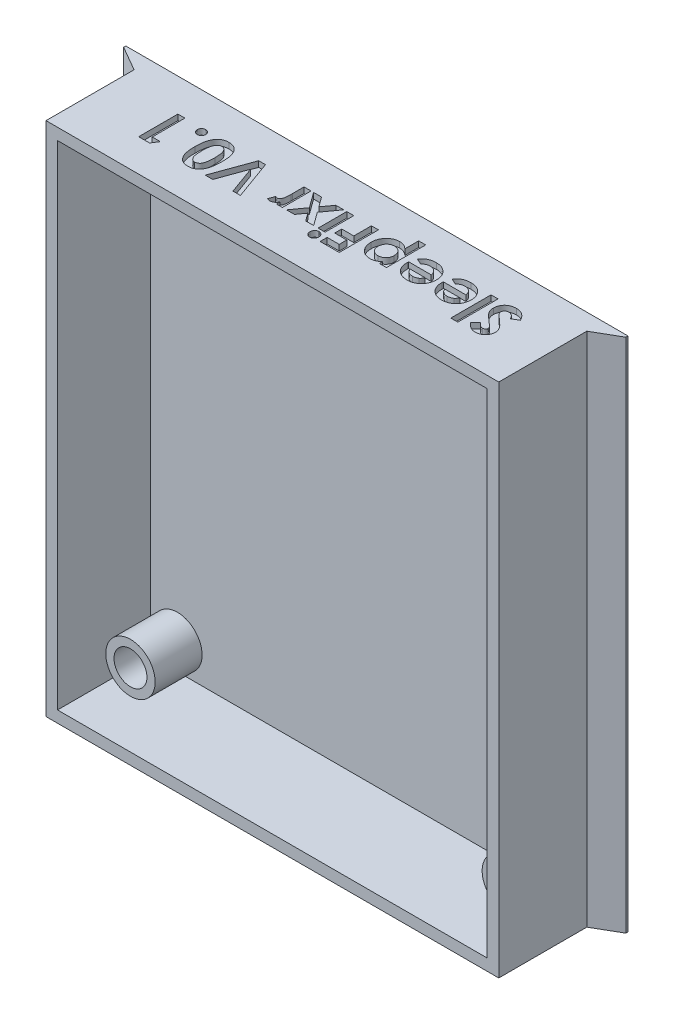
from build123d import *

# Parameters (mm, degrees)
SKETCH1_W                 = 55
SKETCH1_H                 = 62.7
BOSS_EXTRUDE1_DEPTH       = 12.7
SHELL1_T                  = -1.4
SKETCH2_R                 = 3
SKETCH2_R_2               = 2
BOSS_EXTRUDE2_DEPTH       = 5.7
SKETCH3_W                 = 3
SKETCH3_H                 = 62.7
BOSS_EXTRUDE3_DEPTH       = 2
CHAMFER1_SIZE2            = 3
CHAMFER1_SIZE             = 1.732050808
CHAMFER1_OF_MIRROR1_SIZE2 = 1.732050808
CHAMFER1_OF_MIRROR1_SIZE  = 3
SKETCH4_W                 = 0.854807692
SKETCH4_H                 = 3.480288462
SKETCH4_H_2               = 4.884615385
CUT_EXTRUDE1_DEPTH        = 0.7


with BuildPart() as part:
    # Sketch1 → Boss-Extrude1 (new body)
    with BuildSketch(Plane.XY):
        Rectangle(SKETCH1_W, SKETCH1_H)
    extrude(amount=BOSS_EXTRUDE1_DEPTH)

    # Shell1
    shell1_openings = [part.faces().sort_by_distance(p)[0] for p in [
        (0, 0, 12.7),
    ]]
    offset(amount=SHELL1_T, openings=shell1_openings, kind=Kind.INTERSECTION)

    # Sketch2 → Boss-Extrude2 (add)
    # profile 1 of 3: a face of its own
    with BuildSketch(Plane.XY.offset(1.4)):
        with Locations((22.882499365, 26.652311405)):
            Circle(SKETCH2_R)
        with Locations((22.882499365, 26.652311405)):
            Circle(SKETCH2_R_2, mode=Mode.SUBTRACT)
    # profile 2 of 3: a face of its own
    with BuildSketch(Plane.XY.offset(1.4)):
        with Locations((22.882499365, -26.687795276)):
            Circle(SKETCH2_R)
        with Locations((22.882499365, -26.687795276)):
            Circle(SKETCH2_R_2, mode=Mode.SUBTRACT)
    # profile 3 of 3: a face of its own
    with BuildSketch(Plane.XY.offset(1.4)):
        with Locations((-22.837592075, -26.687795276)):
            Circle(SKETCH2_R)
        with Locations((-22.837592075, -26.687795276)):
            Circle(SKETCH2_R_2, mode=Mode.SUBTRACT)
    extrude(amount=BOSS_EXTRUDE2_DEPTH)

    # Sketch3 → Boss-Extrude3 (add)
    with BuildSketch(Plane(origin=(0, 0, 0), x_dir=(-1, 0, 0), z_dir=(0, 0, -1))):
        with Locations((-29, 0)):
            Rectangle(SKETCH3_W, SKETCH3_H)
    boss_extrude3 = extrude(amount=-BOSS_EXTRUDE3_DEPTH)

    # Chamfer1
    chamfer1_edges = [part.edges().sort_by_distance(p)[0] for p in [
        (30.5, 0, 2),
    ]]
    chamfer1_side = [part.faces().sort_by_distance(p)[0] for p in [
        (30.5, 0, 1.965358984),
    ]]
    chamfer(chamfer1_edges, length=CHAMFER1_SIZE - 0.0001, length2=CHAMFER1_SIZE2 - 0.0001, reference=chamfer1_side[0])  # a hair under: the kernel refuses the full size

    # Mirror1: Boss-Extrude3 across plane
    add(boss_extrude3.mirror(Plane.ZY))

    # Chamfer1 of Mirror1
    chamfer1_of_mirror1_edges = [part.edges().sort_by_distance(p)[0] for p in [
        (-30.5, 0, 2),
    ]]
    chamfer1_of_mirror1_side = [part.faces().sort_by_distance(p)[0] for p in [
        (-30.465358984, 0, 2),
    ]]
    chamfer(chamfer1_of_mirror1_edges, length=CHAMFER1_OF_MIRROR1_SIZE - 0.0001, length2=CHAMFER1_OF_MIRROR1_SIZE2 - 0.0001, reference=chamfer1_of_mirror1_side[0])  # a hair under: the kernel refuses the full size

    # Sketch4 → Cut-Extrude1 (cut)
    # profile 1 of 14: a face of its own
    with BuildSketch(Plane(origin=(0, 31.35, 0), x_dir=(1, 0, 0), z_dir=(0, 1, 0))):
        Polygon((-18.858240685, -8.7625), (-20.179567308, -8.7625), (-20.179567308, -4), (-19.324759615, -4), (-19.324759615, -7.96875), (-18.347836538, -7.96875), align=None)
    # profile 2 of 14: a face of its own
    with BuildSketch(Plane(origin=(0, 31.35, 0), x_dir=(1, 0, 0), z_dir=(0, 1, 0))):
        with BuildLine():
            add(Edge.make_bspline(
                [(-16.851923077, -4.976923077), (-16.88648121, -4.975170656), (-16.954609534, -4.971715911), (-17.052252057, -4.941816778), (-17.142258153, -4.89417224), (-17.221144645, -4.828234163), (-17.288485226, -4.750349167), (-17.335515267, -4.660366441), (-17.365951292, -4.562915366), (-17.369233546, -4.494736101), (-17.370913462, -4.459840745)],
                knots=[0, 0, 0, 0, 1.016706445, 2.004347467, 2.981433789, 4.000427929, 5.018214116, 5.995300439, 6.973959266, 8, 8, 8, 8], degree=3))
            add(Edge.make_bspline(
                [(-17.370913462, -4.459840745), (-17.369191428, -4.424958845), (-17.365811807, -4.356500506), (-17.335769318, -4.258581962), (-17.288208584, -4.168278777), (-17.221231288, -4.08954172), (-17.14227775, -4.022784714), (-17.052508806, -3.973871808), (-16.95458068, -3.94420686), (-16.886471499, -3.940714042), (-16.851923077, -3.938942308)],
                knots=[0, 0, 0, 0, 1.022642663, 2.007012786, 2.980863166, 4.002438329, 5.024013493, 6.00229059, 6.986660713, 8, 8, 8, 8], degree=3))
            add(Edge.make_bspline(
                [(-16.851923077, -3.938942308), (-16.817382841, -3.94072857), (-16.7492898, -3.944250029), (-16.65151363, -3.973624158), (-16.562402693, -4.023115211), (-16.483468551, -4.089460528), (-16.416791152, -4.168562207), (-16.367858545, -4.258292848), (-16.338103239, -4.356538162), (-16.334677981, -4.424971556), (-16.332932692, -4.459840745)],
                knots=[0, 0, 0, 0, 1.013817282, 1.998651736, 2.969187861, 3.991244904, 5.013301947, 5.9920405, 6.976874954, 8, 8, 8, 8], degree=3))
            add(Edge.make_bspline(
                [(-16.332932692, -4.459840745), (-16.334635886, -4.494723381), (-16.337963621, -4.562877794), (-16.368115617, -4.660653997), (-16.416511774, -4.750067386), (-16.483556563, -4.828314372), (-16.562417355, -4.893844409), (-16.65177368, -4.942064004), (-16.749260352, -4.971673069), (-16.817372931, -4.975156238), (-16.851923077, -4.976923077)],
                knots=[0, 0, 0, 0, 1.02653117, 2.005657786, 2.987654694, 4.005927372, 5.02540858, 5.994694477, 6.98280758, 8, 8, 8, 8], degree=3))
        make_face()
    # profile 3 of 14: a face of its own
    with BuildSketch(Plane(origin=(0, 31.35, 0), x_dir=(1, 0, 0), z_dir=(0, 1, 0))):
        with BuildLine():
            add(Edge.make_bspline(
                [(-14.090016526, -8.884615385), (-14.131392873, -8.884001347), (-14.212749825, -8.882793985), (-14.332571477, -8.869710007), (-14.447999865, -8.849958815), (-14.559453887, -8.822359472), (-14.666249998, -8.7860242), (-14.768851011, -8.741796178), (-14.867507786, -8.690496318), (-14.961328007, -8.630061593), (-15.049930649, -8.561298126), (-15.133926284, -8.484413284), (-15.211581014, -8.398158905), (-15.285654036, -8.304640584), (-15.35320699, -8.201797888), (-15.416166297, -8.091308967), (-15.4735746, -7.971992628), (-15.526232682, -7.843767138), (-15.573338021, -7.704677635), (-15.612903438, -7.553116455), (-15.647300257, -7.389191281), (-15.674388775, -7.212048399), (-15.69656007, -7.022105588), (-15.711046552, -6.819007443), (-15.721124346, -6.603322321), (-15.721937836, -6.455358786), (-15.722355769, -6.379341947)],
                knots=[0, 0, 0, 0, 0.879038005, 1.72842358, 2.558443055, 3.366573136, 4.165922485, 4.953092809, 5.739101687, 6.526504095, 7.321412341, 8.120218626, 8.943108119, 9.785446297, 10.653345205, 11.555363108, 12.486387694, 13.465363381, 14.499809521, 15.604758044, 16.79243262, 18.058048538, 19.411969755, 20.855614229, 22.384559651, 24, 24, 24, 24], degree=3))
            add(Edge.make_bspline(
                [(-15.722355769, -6.379341947), (-15.721900857, -6.302374545), (-15.721016969, -6.152828264), (-15.711496236, -5.935163625), (-15.695095899, -5.730614329), (-15.67397423, -5.539196155), (-15.644987344, -5.361028441), (-15.611282511, -5.195889022), (-15.570647072, -5.043735715), (-15.522245464, -4.904593165), (-15.469637457, -4.775939798), (-15.41257836, -4.656802745), (-15.351105136, -4.54624768), (-15.285883887, -4.444015781), (-15.214764529, -4.351373911), (-15.140687291, -4.266969626), (-15.061537784, -4.191984269), (-14.978593936, -4.124810328), (-14.889815899, -4.066013824), (-14.795600537, -4.01549885), (-14.695310414, -3.973753165), (-14.590404965, -3.937770904), (-14.479017814, -3.911883424), (-14.36286885, -3.891359471), (-14.240660863, -3.880013002), (-14.157456194, -3.878605721), (-14.114821214, -3.877884615)],
                knots=[0, 0, 0, 0, 1.643729521, 3.193736973, 4.651750042, 6.025799905, 7.305391353, 8.505533933, 9.624215592, 10.665924642, 11.64969722, 12.591402044, 13.485259159, 14.34997443, 15.17859563, 15.977254476, 16.745893235, 17.504291679, 18.254003551, 19.016677942, 19.783634514, 20.571857866, 21.382327253, 22.223106266, 23.08950026, 24, 24, 24, 24], degree=3))
            add(Edge.make_bspline(
                [(-14.114821214, -3.877884615), (-14.0721883, -3.87862288), (-13.988671048, -3.88006913), (-13.866119735, -3.89123908), (-13.74909686, -3.912149227), (-13.636659091, -3.937585901), (-13.529875844, -3.974021319), (-13.427531096, -4.016147142), (-13.331374104, -4.068309221), (-13.239630268, -4.126593609), (-13.15376756, -4.193777083), (-13.072508088, -4.26878801), (-12.994716578, -4.350579274), (-12.923164073, -4.441991758), (-12.856571092, -4.541356), (-12.794230202, -4.64865804), (-12.737410367, -4.764249057), (-12.684200612, -4.888096176), (-12.637158607, -5.023177678), (-12.596453692, -5.170736525), (-12.562546797, -5.332040342), (-12.533518644, -5.506374067), (-12.513837155, -5.694742298), (-12.497059724, -5.896034588), (-12.48766062, -6.110852747), (-12.486761168, -6.258490179), (-12.486298077, -6.334502704)],
                knots=[0, 0, 0, 0, 0.917300563, 1.796978314, 2.644037383, 3.473869551, 4.274468802, 5.068727038, 5.852392514, 6.624895937, 7.405058545, 8.194438634, 9.002807344, 9.831001702, 10.688798588, 11.574866558, 12.499006576, 13.458565112, 14.473491784, 15.574131657, 16.749764288, 18.018652109, 19.374999853, 20.823441246, 22.364518758, 24, 24, 24, 24], degree=3))
            add(Edge.make_bspline(
                [(-12.486298077, -6.334502704), (-12.487127376, -6.440115737), (-12.488727519, -6.643897444), (-12.508485798, -6.938344289), (-12.538374699, -7.210307689), (-12.579290307, -7.460116252), (-12.634399174, -7.687281024), (-12.702029687, -7.891736753), (-12.779631168, -8.075507288), (-12.845652456, -8.184391695), (-12.877448918, -8.23683143)],
                knots=[0, 0, 0, 0, 1.288526675, 2.486228817, 3.599112392, 4.626206381, 5.5730174, 6.447949553, 7.252518174, 8, 8, 8, 8], degree=3))
            add(Edge.make_bspline(
                [(-12.877448918, -8.23683143), (-12.91442772, -8.288346782), (-12.986728563, -8.389069447), (-13.113148608, -8.521299478), (-13.248970487, -8.634389076), (-13.396983903, -8.725778921), (-13.554847964, -8.79784896), (-13.723918011, -8.848751217), (-13.903569698, -8.878409244), (-14.026939508, -8.882515779), (-14.090016526, -8.884615385)],
                knots=[0, 0, 0, 0, 1.058512271, 2.069600068, 3.047294572, 4.004278952, 4.967380941, 5.939006123, 6.946246673, 8, 8, 8, 8], degree=3))
        make_face()
        with BuildLine():
            add(Edge.make_bspline(
                [(-14.111005108, -8.029807692), (-14.073611374, -8.028015768), (-14.000299806, -8.024502646), (-13.894017316, -7.995347455), (-13.794674918, -7.948992675), (-13.71778794, -7.895722875), (-13.661145954, -7.842649374), (-13.619902509, -7.796143311), (-13.582979834, -7.741708937), (-13.547395709, -7.681727301), (-13.51541174, -7.614370305), (-13.484590672, -7.541443877), (-13.458253375, -7.461117968), (-13.433074809, -7.374080335), (-13.411344946, -7.278176415), (-13.392190519, -7.172509366), (-13.376450876, -7.05661105), (-13.362718939, -6.93035352), (-13.354113348, -6.793764977), (-13.345743382, -6.646879243), (-13.342702885, -6.489383651), (-13.341649429, -6.380931524), (-13.341105769, -6.32496244)],
                knots=[0, 0, 0, 0, 1.076633864, 2.110773886, 3.152647947, 4.225997476, 4.790367519, 5.388085217, 6.013768813, 6.68363944, 7.397140436, 8.161658524, 8.964785566, 9.832512219, 10.773307679, 11.798385074, 12.927758018, 14.144797317, 15.459104848, 16.872968649, 18.386227327, 20, 20, 20, 20], degree=3))
            add(Edge.make_bspline(
                [(-13.341105769, -6.32496244), (-13.341978709, -6.252450261), (-13.343652635, -6.113402782), (-13.352395034, -5.913448599), (-13.370023761, -5.731157324), (-13.391718636, -5.565935193), (-13.422111422, -5.418301448), (-13.459325946, -5.28829328), (-13.500792204, -5.174451795), (-13.552757411, -5.07872825), (-13.608438676, -4.9968658), (-13.667868459, -4.926050491), (-13.732084681, -4.867060525), (-13.799167547, -4.816979208), (-13.871604864, -4.779790903), (-13.947911255, -4.752679431), (-14.028256117, -4.736148924), (-14.08326266, -4.733851174), (-14.111005108, -4.732692308)],
                knots=[0, 0, 0, 0, 1.772038313, 3.39801485, 4.888833602, 6.246074539, 7.468356166, 8.567794639, 9.549176812, 10.42180448, 11.221452581, 11.965716786, 12.675085657, 13.348110381, 14.005015947, 14.656336226, 15.322325655, 16, 16, 16, 16], degree=3))
            add(Edge.make_bspline(
                [(-14.111005108, -4.732692308), (-14.137796557, -4.73348435), (-14.190250881, -4.735035069), (-14.266741034, -4.750952999), (-14.339075557, -4.776832094), (-14.407036051, -4.813439892), (-14.4708656, -4.859992308), (-14.530252246, -4.916693913), (-14.584748105, -4.98410989), (-14.61649764, -5.034142516), (-14.632857572, -5.059923377)],
                knots=[0, 0, 0, 0, 0.992283464, 1.942767638, 2.88273346, 3.832339453, 4.79467288, 5.803907806, 6.868395428, 8, 8, 8, 8], degree=3))
            add(Edge.make_bspline(
                [(-14.632857572, -5.059923377), (-14.652124585, -5.095150923), (-14.692525947, -5.169020228), (-14.73915991, -5.293696712), (-14.778942253, -5.434134081), (-14.81083286, -5.591467852), (-14.836092362, -5.76506673), (-14.855403256, -5.955059738), (-14.865211909, -6.161719212), (-14.866749152, -6.304919082), (-14.867548077, -6.379341947)],
                knots=[0, 0, 0, 0, 0.710996797, 1.490902623, 2.352723643, 3.296875318, 4.334065587, 5.461510359, 6.680713396, 8, 8, 8, 8], degree=3))
            add(Edge.make_bspline(
                [(-14.867548077, -6.379341947), (-14.867233962, -6.454408529), (-14.866629345, -6.598898885), (-14.855536352, -6.80633178), (-14.840088536, -6.995787332), (-14.817492763, -7.166842438), (-14.78841943, -7.31991275), (-14.752585697, -7.454986975), (-14.710342698, -7.572335375), (-14.660240272, -7.671828194), (-14.604771604, -7.756413374), (-14.545814382, -7.828880671), (-14.483266652, -7.891269361), (-14.416454493, -7.941838043), (-14.345823774, -7.982142572), (-14.270993412, -8.009609255), (-14.192212338, -8.026505836), (-14.138439549, -8.028692218), (-14.111005108, -8.029807692)],
                knots=[0, 0, 0, 0, 1.793903324, 3.452957663, 4.963427329, 6.336122014, 7.574844885, 8.684777121, 9.673127442, 10.55010789, 11.340650774, 12.086136756, 12.779466299, 13.446812155, 14.083183996, 14.715685896, 15.34475337, 16, 16, 16, 16], degree=3))
        make_face(mode=Mode.SUBTRACT)
    # profile 4 of 14: a face of its own
    with BuildSketch(Plane(origin=(0, 31.35, 0), x_dir=(1, 0, 0), z_dir=(0, 1, 0))):
        Polygon((-7.815384615, -8.7625), (-8.728387921, -8.7625), (-9.952403846, -5.379522236), (-11.179281851, -8.7625), (-12.089423077, -8.7625), (-10.362635216, -4), (-9.539310397, -4), align=None)
    # profile 5 of 14: a face of its own
    with BuildSketch(Plane(origin=(0, 31.35, 0), x_dir=(1, 0, 0), z_dir=(0, 1, 0))):
        with BuildLine():
            Line((-3.999278846, -7.480288462), (-4.731971154, -7.480288462))
            Line((-4.731971154, -7.480288462), (-4.731971154, -7.051930589))
            add(Edge.make_bspline(
                [(-4.731971154, -7.051930589), (-4.752677091, -7.090020784), (-4.793147705, -7.164469651), (-4.867990155, -7.264219914), (-4.952841229, -7.34973436), (-5.047552476, -7.419057565), (-5.14889311, -7.474176198), (-5.256253464, -7.511979569), (-5.367754596, -7.537438636), (-5.444168735, -7.540034269), (-5.482789964, -7.541346154)],
                knots=[0, 0, 0, 0, 1.098409642, 2.146887215, 3.15060926, 4.142663133, 5.113340811, 6.064933309, 7.021978713, 8, 8, 8, 8], degree=3))
            add(Edge.make_bspline(
                [(-5.482789964, -7.541346154), (-5.510853611, -7.540152582), (-5.568058591, -7.537719604), (-5.654650809, -7.520255162), (-5.743431323, -7.494090346), (-5.801365776, -7.468551476), (-5.831009615, -7.455483774)],
                knots=[0, 0, 0, 0, 0.931681262, 1.899140464, 2.92503444, 4, 4, 4, 4], degree=3))
            Line((-5.831009615, -7.455483774), (-5.565790264, -6.731377704))
            add(Edge.make_bspline(
                [(-5.565790264, -6.731377704), (-5.542083442, -6.742831695), (-5.497523741, -6.764360788), (-5.432830793, -6.789767335), (-5.37411926, -6.805269169), (-5.336897226, -6.807582178), (-5.319651442, -6.808653846)],
                knots=[0, 0, 0, 0, 1.214386998, 2.282580073, 3.20428172, 4, 4, 4, 4], degree=3))
            add(Edge.make_bspline(
                [(-5.319651442, -6.808653846), (-5.303364016, -6.807949719), (-5.271323842, -6.806564581), (-5.224104273, -6.794505283), (-5.17918814, -6.774137433), (-5.136242802, -6.746304674), (-5.095371153, -6.710871191), (-5.056011281, -6.668063715), (-5.020819005, -6.615636757), (-4.983808079, -6.557112416), (-4.952284203, -6.48553132), (-4.925151654, -6.400078714), (-4.901487008, -6.299637689), (-4.882923322, -6.184203804), (-4.869043506, -6.053924367), (-4.858835513, -5.908818528), (-4.851931321, -5.748796658), (-4.851466637, -5.637117264), (-4.851224459, -5.578913762)],
                knots=[0, 0, 0, 0, 0.544259334, 1.070651881, 1.618331981, 2.187895439, 2.776420197, 3.424094598, 4.12659612, 4.885633066, 5.737955424, 6.733832302, 7.882163033, 9.186958323, 10.642647142, 12.264016219, 14.052932313, 16, 16, 16, 16], degree=3))
            Line((-4.851224459, -5.578913762), (-4.854086538, -5.409097055))
            Line((-4.854086538, -5.409097055), (-4.854086538, -4))
            Line((-4.854086538, -4), (-3.999278846, -4))
            Line((-3.999278846, -4), (-3.999278846, -7.480288462))
        make_face()
    # profile 6 of 14: a face of its own
    with BuildSketch(Plane(origin=(0, 31.35, 0), x_dir=(1, 0, 0), z_dir=(0, 1, 0))):
        Polygon((-0.205115685, -7.480288462), (-1.169636418, -7.480288462), (-1.857489483, -6.531986178), (-2.542480469, -7.480288462), (-3.507001202, -7.480288462), (-2.341180889, -5.865121695), (-3.693990385, -4), (-2.729469651, -4), (-1.860351563, -5.198257212), (-0.995049579, -4), (-0.030528846, -4), (-1.376660156, -5.865121695), align=None)
    # profile 7 of 14: a face of its own
    with BuildSketch(Plane(origin=(0, 31.35, 0), x_dir=(1, 0, 0), z_dir=(0, 1, 0))):
        with BuildLine():
            add(Edge.make_bspline(
                [(0.765129207, -8.945673077), (0.728273823, -8.943887674), (0.655904726, -8.940381862), (0.552602814, -8.905513953), (0.456864249, -8.852567993), (0.373271994, -8.777720228), (0.302544887, -8.68904888), (0.251414064, -8.588072782), (0.219530178, -8.478198127), (0.215671751, -8.401777603), (0.213701923, -8.362762921)],
                knots=[0, 0, 0, 0, 0.989651449, 1.943275965, 2.90597644, 3.919767043, 4.944608933, 5.944551278, 6.950639519, 8, 8, 8, 8], degree=3))
            add(Edge.make_bspline(
                [(0.213701923, -8.362762921), (0.215795756, -8.324106465), (0.219892293, -8.248475986), (0.249893318, -8.139295447), (0.302163384, -8.040518812), (0.371136012, -7.951961084), (0.45538415, -7.879684457), (0.548363394, -7.823993045), (0.651081646, -7.791390775), (0.722292801, -7.787534824), (0.758451022, -7.785576923)],
                knots=[0, 0, 0, 0, 1.052725588, 2.059633778, 3.055596988, 4.079986438, 5.099674807, 6.062641398, 7.01628558, 8, 8, 8, 8], degree=3))
            add(Edge.make_bspline(
                [(0.758451022, -7.785576923), (0.795601669, -7.787400076), (0.868548432, -7.79097991), (0.973380691, -7.825393409), (1.069153625, -7.880618302), (1.153376729, -7.956306476), (1.223328106, -8.046203859), (1.276735622, -8.146774626), (1.306577937, -8.258377079), (1.31065072, -8.335562801), (1.312740385, -8.375165264)],
                knots=[0, 0, 0, 0, 0.989280592, 1.942491504, 2.912382296, 3.922750976, 4.94514089, 5.940052451, 6.943081751, 8, 8, 8, 8], degree=3))
            add(Edge.make_bspline(
                [(1.312740385, -8.375165264), (1.310629595, -8.413191266), (1.306483255, -8.487887857), (1.276459788, -8.595730711), (1.224451552, -8.694095969), (1.153858837, -8.780398004), (1.071520342, -8.854511955), (0.976406417, -8.906771317), (0.873530152, -8.940013367), (0.801635952, -8.943767027), (0.765129207, -8.945673077)],
                knots=[0, 0, 0, 0, 1.038763745, 2.040501419, 3.031928819, 4.058179968, 5.07455544, 6.03952971, 7.004503979, 8, 8, 8, 8], degree=3))
        make_face()
    # profile 8 of 14: a face of its own
    with BuildSketch(Plane(origin=(0, 31.35, 0), x_dir=(1, 0, 0), z_dir=(0, 1, 0))):
        with Locations((0.763221154, -5.740144231)):
            Rectangle(SKETCH4_W, SKETCH4_H)
    # profile 9 of 14: a face of its own
    with BuildSketch(Plane(origin=(0, 31.35, 0), x_dir=(1, 0, 0), z_dir=(0, 1, 0))):
        Polygon((4.182451923, -8.7625), (1.862259615, -8.7625), (1.862259615, -7.907692308), (3.327644231, -7.907692308), (3.327644231, -6.991826923), (1.862259615, -6.991826923), (1.862259615, -6.137019231), (3.327644231, -6.137019231), (3.327644231, -4), (4.182451923, -4), align=None)
    # profile 10 of 14: a face of its own
    with BuildSketch(Plane(origin=(0, 31.35, 0), x_dir=(1, 0, 0), z_dir=(0, 1, 0))):
        with BuildLine():
            Line((7.784855769, -7.480288462), (7.784855769, -7.088183594))
            add(Edge.make_bspline(
                [(7.784855769, -7.088183594), (7.745167826, -7.124639605), (7.6672248, -7.19623545), (7.539662981, -7.287996986), (7.408258311, -7.366499054), (7.271896212, -7.430851243), (7.130841843, -7.481453674), (6.984283053, -7.514381872), (6.833516284, -7.538309756), (6.731072946, -7.540324683), (6.679139123, -7.541346154)],
                knots=[0, 0, 0, 0, 1.054187817, 2.070316091, 3.069675674, 4.047174656, 5.017909683, 5.996439029, 6.984291385, 8, 8, 8, 8], degree=3))
            add(Edge.make_bspline(
                [(6.679139123, -7.541346154), (6.623080641, -7.540005596), (6.512663622, -7.537365132), (6.35022541, -7.512641962), (6.194482415, -7.472843373), (6.045329949, -7.416742424), (5.901935275, -7.345981096), (5.765620001, -7.257858216), (5.636227924, -7.153581984), (5.513536177, -7.036119509), (5.401833593, -6.905530147), (5.303964812, -6.764612963), (5.221172443, -6.614799841), (5.154596233, -6.455586077), (5.101931512, -6.287603601), (5.063599791, -6.110803569), (5.041760084, -5.924822071), (5.038779217, -5.798078177), (5.037259615, -5.733466046)],
                knots=[0, 0, 0, 0, 0.985951178, 1.942003901, 2.883982064, 3.810134859, 4.741144248, 5.692715104, 6.660213483, 7.661561108, 8.67767141, 9.678956482, 10.675837386, 11.68402661, 12.710593111, 13.769816723, 14.863086109, 16, 16, 16, 16], degree=3))
            add(Edge.make_bspline(
                [(5.037259615, -5.733466046), (5.038706577, -5.671068664), (5.041558857, -5.548069667), (5.064667857, -5.367513283), (5.103673281, -5.194968643), (5.158905594, -5.030785763), (5.227001582, -4.873501803), (5.312804457, -4.724649372), (5.414606021, -4.584357989), (5.529440846, -4.452399836), (5.654672622, -4.332239153), (5.788234887, -4.228052927), (5.926115226, -4.137941742), (6.070874794, -4.065363619), (6.221451121, -4.008476412), (6.377688256, -3.969036543), (6.539270418, -3.942578832), (6.649138822, -3.940166556), (6.704897837, -3.938942308)],
                knots=[0, 0, 0, 0, 1.098516344, 2.165417921, 3.19923846, 4.20863973, 5.211651828, 6.212566914, 7.227467783, 8.259481857, 9.28930572, 10.278496837, 11.238453968, 12.185121121, 13.124355233, 14.066972242, 15.018974356, 16, 16, 16, 16], degree=3))
            add(Edge.make_bspline(
                [(6.704897837, -3.938942308), (6.754578526, -3.94017476), (6.852446495, -3.942602618), (6.996537651, -3.963384426), (7.135320506, -3.996483746), (7.269526724, -4.043974001), (7.401151726, -4.105813794), (7.531023051, -4.184735937), (7.660578548, -4.280693365), (7.74254123, -4.354800109), (7.784855769, -4.393058894)],
                knots=[0, 0, 0, 0, 0.991011278, 1.952232586, 2.89886686, 3.834201722, 4.788083509, 5.795919256, 6.862108243, 8, 8, 8, 8], degree=3))
            Line((7.784855769, -4.393058894), (7.784855769, -2.717788462))
            Line((7.784855769, -2.717788462), (8.639663462, -2.717788462))
            Line((8.639663462, -2.717788462), (8.639663462, -7.480288462))
            Line((8.639663462, -7.480288462), (7.784855769, -7.480288462))
        make_face()
        with BuildLine():
            add(Edge.make_bspline(
                [(6.864220252, -6.747596154), (6.898911009, -6.746529533), (6.96692375, -6.744438376), (7.06677697, -6.732450409), (7.161396765, -6.709905867), (7.252188431, -6.68065054), (7.338124096, -6.641291829), (7.419290648, -6.59320061), (7.496690186, -6.537800658), (7.567333181, -6.47254592), (7.633542492, -6.40212396), (7.689469524, -6.323771487), (7.739105159, -6.241775312), (7.778060108, -6.153088795), (7.808487176, -6.05940741), (7.830682338, -5.960765063), (7.842812479, -5.8568377), (7.844863452, -5.785967145), (7.845913462, -5.749684495)],
                knots=[0, 0, 0, 0, 1.060361231, 2.078884446, 3.066575369, 4.028447752, 4.989534372, 5.947865746, 6.908116788, 7.891927729, 8.882292221, 9.856117424, 10.827758235, 11.806564921, 12.808401015, 13.833992741, 14.891098244, 16, 16, 16, 16], degree=3))
            add(Edge.make_bspline(
                [(7.845913462, -5.749684495), (7.844849247, -5.712767313), (7.842760679, -5.640315755), (7.830744983, -5.534166076), (7.808656877, -5.433570103), (7.77786474, -5.338426195), (7.739112909, -5.248119188), (7.689756454, -5.164319154), (7.633527743, -5.084901118), (7.567404263, -5.013426619), (7.496411718, -4.94737098), (7.419601754, -4.889956537), (7.338402368, -4.840658305), (7.251768142, -4.802127491), (7.16181841, -4.769783605), (7.066715274, -4.748017753), (6.966940121, -4.735802402), (6.898916539, -4.733742822), (6.864220252, -4.732692308)],
                knots=[0, 0, 0, 0, 1.117458908, 2.193061219, 3.227575974, 4.228922649, 5.21592104, 6.19481524, 7.167063136, 8.15499956, 9.135831651, 10.098264655, 11.052287748, 12.004123772, 12.962940859, 13.941125115, 14.949844898, 16, 16, 16, 16], degree=3))
            add(Edge.make_bspline(
                [(6.864220252, -4.732692308), (6.83078246, -4.733656014), (6.764594811, -4.735563599), (6.667511284, -4.749274595), (6.574225677, -4.77068892), (6.485737269, -4.803142763), (6.400467805, -4.842616266), (6.320068551, -4.89307302), (6.243426102, -4.951514483), (6.171451835, -5.017836868), (6.105537845, -5.091002925), (6.048473764, -5.170101614), (5.999939554, -5.254087642), (5.961261837, -5.343331611), (5.929196112, -5.436897764), (5.907291126, -5.536076643), (5.895242434, -5.639989258), (5.893136198, -5.71085757), (5.892067308, -5.746822416)],
                knots=[0, 0, 0, 0, 1.021655464, 2.022291768, 2.991178077, 3.941111595, 4.897585522, 5.857755741, 6.835521975, 7.839739059, 8.844614369, 9.839997705, 10.815248905, 11.803059053, 12.808075355, 13.833790882, 14.900674009, 16, 16, 16, 16], degree=3))
            add(Edge.make_bspline(
                [(5.892067308, -5.746822416), (5.893151822, -5.782464393), (5.895288618, -5.852689067), (5.907111159, -5.955726482), (5.929785127, -6.05349909), (5.958842721, -6.14687999), (5.998094122, -6.234832207), (6.046754982, -6.31724977), (6.1015603, -6.396290131), (6.166740553, -6.468149836), (6.237750642, -6.533456334), (6.313253598, -6.591486237), (6.394152026, -6.639395943), (6.479714194, -6.678452123), (6.569230344, -6.710294359), (6.663609216, -6.732311179), (6.76245531, -6.744476882), (6.829843007, -6.746542432), (6.864220252, -6.747596154)],
                knots=[0, 0, 0, 0, 1.094449365, 2.156371669, 3.177111318, 4.171221881, 5.154488592, 6.125613636, 7.106114198, 8.101661685, 9.096538865, 10.064961488, 11.019258098, 11.975848813, 12.948395745, 13.931080756, 14.94455893, 16, 16, 16, 16], degree=3))
        make_face(mode=Mode.SUBTRACT)
    # profile 11 of 14: a face of its own
    with BuildSketch(Plane(origin=(0, 31.35, 0), x_dir=(1, 0, 0), z_dir=(0, 1, 0))):
        with BuildLine():
            Line((9.375217849, -5.526442308), (12.119951923, -5.526442308))
            add(Edge.make_bspline(
                [(12.119951923, -5.526442308), (12.11434155, -5.49455528), (12.103316726, -5.431894754), (12.079711608, -5.341076006), (12.048553468, -5.255551934), (12.012718287, -5.174620013), (11.970785765, -5.098566637), (11.921271684, -5.028406017), (11.86633355, -4.962694314), (11.804930601, -4.902392536), (11.738635944, -4.848200983), (11.667268823, -4.801089219), (11.591991693, -4.760874157), (11.511945027, -4.72841646), (11.427770947, -4.702381137), (11.338911343, -4.684517928), (11.245684239, -4.673942859), (11.1821719, -4.672415393), (11.149707031, -4.671634615)],
                knots=[0, 0, 0, 0, 1.091578896, 2.145038655, 3.15928737, 4.157766048, 5.127497078, 6.082469626, 7.049112333, 8.012179284, 8.980248595, 9.932024523, 10.891502393, 11.853374471, 12.840501167, 13.858428296, 14.905317556, 16, 16, 16, 16], degree=3))
            add(Edge.make_bspline(
                [(11.149707031, -4.671634615), (11.110520065, -4.672669189), (11.033349388, -4.67470657), (10.920293773, -4.692775108), (10.810952523, -4.720066841), (10.706360395, -4.760651938), (10.60530585, -4.81117325), (10.509452559, -4.874116589), (10.417141375, -4.947642543), (10.360820675, -5.004316321), (10.33210637, -5.033210637)],
                knots=[0, 0, 0, 0, 1.021034703, 2.010718019, 2.977989445, 3.954245119, 4.929443971, 5.918328161, 6.938689359, 8, 8, 8, 8], degree=3))
            Line((10.33210637, -5.033210637), (9.616586538, -4.692623197))
            add(Edge.make_bspline(
                [(9.616586538, -4.692623197), (9.639469372, -4.661518159), (9.684700112, -4.600035219), (9.757573875, -4.51330945), (9.832675047, -4.431728992), (9.912079484, -4.357149263), (9.99509513, -4.289428311), (10.081369185, -4.228263347), (10.170435978, -4.172608154), (10.26293759, -4.122653968), (10.360258657, -4.079999492), (10.460888137, -4.041352533), (10.566735221, -4.010451769), (10.676328242, -3.983077821), (10.790885621, -3.963632888), (10.909630248, -3.949256421), (11.032866545, -3.940522181), (11.116620004, -3.939475187), (11.159247296, -3.938942308)],
                knots=[0, 0, 0, 0, 1.033499484, 2.042839079, 3.030732955, 4.00037446, 4.956353854, 5.896509365, 6.829584737, 7.766535667, 8.707846775, 9.672354793, 10.650035223, 11.657650065, 12.694754689, 13.758082582, 14.858950201, 16, 16, 16, 16], degree=3))
            add(Edge.make_bspline(
                [(11.159247296, -3.938942308), (11.224829948, -3.940279341), (11.353269792, -3.942897843), (11.541136288, -3.967201288), (11.719557334, -4.007499027), (11.889036812, -4.062277585), (12.048841823, -4.13460255), (12.199052546, -4.223061592), (12.3411657, -4.325960541), (12.470854305, -4.445452261), (12.588959857, -4.575531938), (12.69285868, -4.715155372), (12.779277034, -4.863798248), (12.852363691, -5.019042626), (12.905943148, -5.183776922), (12.946385468, -5.355659553), (12.970740107, -5.535922022), (12.973404796, -5.658659667), (12.974759615, -5.721063702)],
                knots=[0, 0, 0, 0, 1.103528868, 2.161197684, 3.181904866, 4.17893931, 5.15400521, 6.128071465, 7.108807125, 8.101535823, 9.090664498, 10.062772592, 11.024896103, 11.980490186, 12.945349712, 13.934753549, 14.949957771, 16, 16, 16, 16], degree=3))
            add(Edge.make_bspline(
                [(12.974759615, -5.721063702), (12.973401803, -5.785057399), (12.970730369, -5.910962123), (12.946480718, -6.095331524), (12.906227008, -6.271262841), (12.850553379, -6.438914267), (12.780588852, -6.599265083), (12.691332325, -6.749606547), (12.588158743, -6.892295221), (12.470351096, -7.025374287), (12.340142203, -7.145541503), (12.201776151, -7.252672164), (12.053864473, -7.341599358), (11.898306136, -7.414215447), (11.735342818, -7.47251766), (11.563296847, -7.511548279), (11.383611803, -7.537707805), (11.260788313, -7.540120092), (11.19836238, -7.541346154)],
                knots=[0, 0, 0, 0, 1.079354094, 2.123580709, 3.131027717, 4.120248802, 5.100347326, 6.076737579, 7.064152558, 8.067633759, 9.069995403, 10.049814825, 11.015114092, 11.975254693, 12.94256508, 13.929104949, 14.947452504, 16, 16, 16, 16], degree=3))
            add(Edge.make_bspline(
                [(11.19836238, -7.541346154), (11.132463807, -7.539992018), (11.003078752, -7.537333313), (10.813928329, -7.513175779), (10.634234411, -7.472817366), (10.463598084, -7.417797526), (10.302345165, -7.345913369), (10.151043755, -7.257525458), (10.008811305, -7.153973601), (9.877610954, -7.034779666), (9.758883558, -6.902887708), (9.654480269, -6.759742251), (9.568024877, -6.605227534), (9.495831457, -6.441511947), (9.440613047, -6.267400377), (9.400577959, -6.083504888), (9.376282389, -5.888988719), (9.373684531, -5.755797753), (9.372355769, -5.687672776)],
                knots=[0, 0, 0, 0, 1.079725433, 2.119929612, 3.118887298, 4.094664154, 5.053604992, 6.006563715, 6.961515899, 7.932002515, 8.906358438, 9.865525889, 10.829453997, 11.80269401, 12.793349889, 13.817750914, 14.883815678, 16, 16, 16, 16], degree=3))
            Line((9.372355769, -5.687672776), (9.375217849, -5.526442308))
        make_face()
        with BuildLine():
            add(Edge.make_bspline(
                [(10.227163462, -6.198076923), (10.243133216, -6.241715287), (10.274849467, -6.328381948), (10.349614155, -6.446142806), (10.44343065, -6.551419108), (10.555943893, -6.642335062), (10.683253712, -6.717235406), (10.823568859, -6.769135115), (10.972847881, -6.803340359), (11.076052331, -6.806858506), (11.12871845, -6.808653846)],
                knots=[0, 0, 0, 0, 0.954548419, 1.89575218, 2.851198576, 3.847292229, 4.862571986, 5.878062886, 6.917157232, 8, 8, 8, 8], degree=3))
            add(Edge.make_bspline(
                [(11.12871845, -6.808653846), (11.186156683, -6.806254154), (11.298346082, -6.801567031), (11.461046352, -6.765252957), (11.613034319, -6.705599417), (11.703574861, -6.647094754), (11.748835637, -6.617848558)],
                knots=[0, 0, 0, 0, 1.045043327, 2.041197553, 3.020804202, 4, 4, 4, 4], degree=3))
            add(Edge.make_bspline(
                [(11.748835637, -6.617848558), (11.77707013, -6.595221128), (11.837454931, -6.546828092), (11.914518498, -6.449658165), (11.992381947, -6.333667058), (12.035809927, -6.245135958), (12.058894231, -6.198076923)],
                knots=[0, 0, 0, 0, 0.821695496, 1.757351177, 2.807911704, 4, 4, 4, 4], degree=3))
            Line((12.058894231, -6.198076923), (10.227163462, -6.198076923))
        make_face(mode=Mode.SUBTRACT)
    # profile 12 of 14: a face of its own
    with BuildSketch(Plane(origin=(0, 31.35, 0), x_dir=(1, 0, 0), z_dir=(0, 1, 0))):
        with BuildLine():
            Line((13.588198618, -5.526442308), (16.332932692, -5.526442308))
            add(Edge.make_bspline(
                [(16.332932692, -5.526442308), (16.32732232, -5.49455528), (16.316297495, -5.431894754), (16.292692377, -5.341076006), (16.261534237, -5.255551934), (16.225699056, -5.174620013), (16.183766535, -5.098566637), (16.134252453, -5.028406017), (16.079314319, -4.962694314), (16.01791137, -4.902392536), (15.951616713, -4.848200983), (15.880249593, -4.801089219), (15.804972463, -4.760874157), (15.724925797, -4.72841646), (15.640751716, -4.702381137), (15.551892112, -4.684517928), (15.458665009, -4.673942859), (15.395152669, -4.672415393), (15.3626878, -4.671634615)],
                knots=[0, 0, 0, 0, 1.091578896, 2.145038655, 3.15928737, 4.157766048, 5.127497078, 6.082469626, 7.049112333, 8.012179284, 8.980248595, 9.932024523, 10.891502393, 11.853374471, 12.840501167, 13.858428296, 14.905317556, 16, 16, 16, 16], degree=3))
            add(Edge.make_bspline(
                [(15.3626878, -4.671634615), (15.323500834, -4.672669189), (15.246330158, -4.67470657), (15.133274542, -4.692775108), (15.023933293, -4.720066841), (14.919341164, -4.760651938), (14.81828662, -4.81117325), (14.722433328, -4.874116589), (14.630122144, -4.947642543), (14.573801444, -5.004316321), (14.545087139, -5.033210637)],
                knots=[0, 0, 0, 0, 1.021034703, 2.010718019, 2.977989445, 3.954245119, 4.929443971, 5.918328161, 6.938689359, 8, 8, 8, 8], degree=3))
            Line((14.545087139, -5.033210637), (13.829567308, -4.692623197))
            add(Edge.make_bspline(
                [(13.829567308, -4.692623197), (13.852450141, -4.661518159), (13.897680881, -4.600035219), (13.970554644, -4.51330945), (14.045655816, -4.431728992), (14.125060253, -4.357149263), (14.208075899, -4.289428311), (14.294349954, -4.228263347), (14.383416747, -4.172608154), (14.475918359, -4.122653968), (14.573239426, -4.079999492), (14.673868906, -4.041352533), (14.77971599, -4.010451769), (14.889309011, -3.983077821), (15.00386639, -3.963632888), (15.122611017, -3.949256421), (15.245847315, -3.940522181), (15.329600773, -3.939475187), (15.372228065, -3.938942308)],
                knots=[0, 0, 0, 0, 1.033499484, 2.042839079, 3.030732955, 4.00037446, 4.956353854, 5.896509365, 6.829584737, 7.766535667, 8.707846775, 9.672354793, 10.650035223, 11.657650065, 12.694754689, 13.758082582, 14.858950201, 16, 16, 16, 16], degree=3))
            add(Edge.make_bspline(
                [(15.372228065, -3.938942308), (15.437810717, -3.940279341), (15.566250562, -3.942897843), (15.754117057, -3.967201288), (15.932538104, -4.007499027), (16.102017582, -4.062277585), (16.261822592, -4.13460255), (16.412033315, -4.223061592), (16.554146469, -4.325960541), (16.683835074, -4.445452261), (16.801940626, -4.575531938), (16.90583945, -4.715155372), (16.992257804, -4.863798248), (17.06534446, -5.019042626), (17.118923918, -5.183776922), (17.159366238, -5.355659553), (17.183720876, -5.535922022), (17.186385565, -5.658659667), (17.187740385, -5.721063702)],
                knots=[0, 0, 0, 0, 1.103528868, 2.161197684, 3.181904866, 4.17893931, 5.15400521, 6.128071465, 7.108807125, 8.101535823, 9.090664498, 10.062772592, 11.024896103, 11.980490186, 12.945349712, 13.934753549, 14.949957771, 16, 16, 16, 16], degree=3))
            add(Edge.make_bspline(
                [(17.187740385, -5.721063702), (17.186382573, -5.785057399), (17.183711138, -5.910962123), (17.159461488, -6.095331524), (17.119207777, -6.271262841), (17.063534148, -6.438914267), (16.993569621, -6.599265083), (16.904313094, -6.749606547), (16.801139512, -6.892295221), (16.683331865, -7.025374287), (16.553122972, -7.145541503), (16.41475692, -7.252672164), (16.266845242, -7.341599358), (16.111286906, -7.414215447), (15.948323587, -7.47251766), (15.776277616, -7.511548279), (15.596592572, -7.537707805), (15.473769082, -7.540120092), (15.411343149, -7.541346154)],
                knots=[0, 0, 0, 0, 1.079354094, 2.123580709, 3.131027717, 4.120248802, 5.100347326, 6.076737579, 7.064152558, 8.067633759, 9.069995403, 10.049814825, 11.015114092, 11.975254693, 12.94256508, 13.929104949, 14.947452504, 16, 16, 16, 16], degree=3))
            add(Edge.make_bspline(
                [(15.411343149, -7.541346154), (15.345444577, -7.539992018), (15.216059521, -7.537333313), (15.026909098, -7.513175779), (14.847215181, -7.472817366), (14.676578854, -7.417797526), (14.515325934, -7.345913369), (14.364024525, -7.257525458), (14.221792074, -7.153973601), (14.090591723, -7.034779666), (13.971864327, -6.902887708), (13.867461038, -6.759742251), (13.781005646, -6.605227534), (13.708812226, -6.441511947), (13.653593816, -6.267400377), (13.613558728, -6.083504888), (13.589263158, -5.888988719), (13.5866653, -5.755797753), (13.585336538, -5.687672776)],
                knots=[0, 0, 0, 0, 1.079725433, 2.119929612, 3.118887298, 4.094664154, 5.053604992, 6.006563715, 6.961515899, 7.932002515, 8.906358438, 9.865525889, 10.829453997, 11.80269401, 12.793349889, 13.817750914, 14.883815678, 16, 16, 16, 16], degree=3))
            Line((13.585336538, -5.687672776), (13.588198618, -5.526442308))
        make_face()
        with BuildLine():
            add(Edge.make_bspline(
                [(14.440144231, -6.198076923), (14.456113985, -6.241715287), (14.487830236, -6.328381948), (14.562594924, -6.446142806), (14.656411419, -6.551419108), (14.768924662, -6.642335062), (14.896234481, -6.717235406), (15.036549628, -6.769135115), (15.185828651, -6.803340359), (15.2890331, -6.806858506), (15.341699219, -6.808653846)],
                knots=[0, 0, 0, 0, 0.954548419, 1.89575218, 2.851198576, 3.847292229, 4.862571986, 5.878062886, 6.917157232, 8, 8, 8, 8], degree=3))
            add(Edge.make_bspline(
                [(15.341699219, -6.808653846), (15.399137453, -6.806254154), (15.511326851, -6.801567031), (15.674027121, -6.765252957), (15.826015088, -6.705599417), (15.91655563, -6.647094754), (15.961816406, -6.617848558)],
                knots=[0, 0, 0, 0, 1.045043327, 2.041197553, 3.020804202, 4, 4, 4, 4], degree=3))
            add(Edge.make_bspline(
                [(15.961816406, -6.617848558), (15.990050899, -6.595221128), (16.0504357, -6.546828092), (16.127499267, -6.449658165), (16.205362716, -6.333667058), (16.248790696, -6.245135958), (16.271875, -6.198076923)],
                knots=[0, 0, 0, 0, 0.821695496, 1.757351177, 2.807911704, 4, 4, 4, 4], degree=3))
            Line((16.271875, -6.198076923), (14.440144231, -6.198076923))
        make_face(mode=Mode.SUBTRACT)
    # profile 13 of 14: a face of its own
    with BuildSketch(Plane(origin=(0, 31.35, 0), x_dir=(1, 0, 0), z_dir=(0, 1, 0))):
        with Locations((18.286778846, -6.442307693)):
            Rectangle(SKETCH4_W, SKETCH4_H_2)
    # profile 14 of 14: a face of its own
    with BuildSketch(Plane(origin=(0, 31.35, 0), x_dir=(1, 0, 0), z_dir=(0, 1, 0))):
        with BuildLine():
            Line((19.507932692, -8.126164363), (20.147130409, -7.541346154))
            add(Edge.make_bspline(
                [(20.147130409, -7.541346154), (20.174505629, -7.579976081), (20.227062235, -7.654140153), (20.312336643, -7.753339184), (20.397101597, -7.838518488), (20.483090202, -7.907242691), (20.568822006, -7.96256784), (20.656118425, -8.000727826), (20.743975175, -8.025268742), (20.803032349, -8.028309798), (20.832121394, -8.029807692)],
                knots=[0, 0, 0, 0, 1.299459705, 2.494781419, 3.587730629, 4.594196874, 5.512431013, 6.380462003, 7.202284646, 8, 8, 8, 8], degree=3))
            add(Edge.make_bspline(
                [(20.832121394, -8.029807692), (20.859265935, -8.028884495), (20.911674912, -8.027102044), (20.986039791, -8.008493047), (21.052869197, -7.978421909), (21.110382976, -7.93688343), (21.15665156, -7.887274432), (21.192628148, -7.834463233), (21.213534214, -7.776881636), (21.216218966, -7.737391169), (21.217548077, -7.717841046)],
                knots=[0, 0, 0, 0, 1.184157716, 2.286297433, 3.324836695, 4.370048774, 5.362957217, 6.276446515, 7.146738784, 8, 8, 8, 8], degree=3))
            add(Edge.make_bspline(
                [(21.217548077, -7.717841046), (21.216706751, -7.698018177), (21.215012438, -7.658097674), (21.19864768, -7.599589205), (21.173981317, -7.54241962), (21.1504116, -7.507617774), (21.138363882, -7.489828726)],
                knots=[0, 0, 0, 0, 0.967525499, 1.948461899, 2.951351359, 4, 4, 4, 4], degree=3))
            add(Edge.make_bspline(
                [(21.138363882, -7.489828726), (21.127367036, -7.476042621), (21.101907484, -7.444125467), (21.054836693, -7.392766343), (20.993288803, -7.332473589), (20.919865191, -7.260209222), (20.83181041, -7.178780249), (20.731015036, -7.085828985), (20.615236487, -6.984512916), (20.534121795, -6.91298839), (20.491533954, -6.875435697)],
                knots=[0, 0, 0, 0, 0.473849886, 1.097042329, 1.870584189, 2.789244661, 3.865562256, 5.093556389, 6.47402294, 8, 8, 8, 8], degree=3))
            add(Edge.make_bspline(
                [(20.491533954, -6.875435697), (20.451463352, -6.840774339), (20.375417674, -6.774994282), (20.267356905, -6.681476518), (20.171771163, -6.59771848), (20.089529764, -6.523092963), (20.018175139, -6.46067314), (19.96086314, -6.406618858), (19.915140932, -6.363294758), (19.889176075, -6.33709699), (19.878094952, -6.325916466)],
                knots=[0, 0, 0, 0, 1.543627419, 2.929484142, 4.163674036, 5.24627963, 6.164986907, 6.925413438, 7.541394495, 8, 8, 8, 8], degree=3))
            add(Edge.make_bspline(
                [(19.878094952, -6.325916466), (19.836029558, -6.280428436), (19.755165099, -6.192984466), (19.650275821, -6.057106974), (19.563018081, -5.92548828), (19.495445896, -5.79441169), (19.446439558, -5.66116838), (19.410764682, -5.523857299), (19.389381037, -5.380515171), (19.387014355, -5.282919335), (19.385817308, -5.23355619)],
                knots=[0, 0, 0, 0, 1.206413378, 2.319150186, 3.339784753, 4.27899982, 5.184598145, 6.099639703, 7.038813909, 8, 8, 8, 8], degree=3))
            add(Edge.make_bspline(
                [(19.385817308, -5.23355619), (19.386670383, -5.185457464), (19.38834415, -5.091085974), (19.408822378, -4.952980946), (19.438064871, -4.820832955), (19.483124104, -4.695965857), (19.53850545, -4.576899875), (19.606001956, -4.463594968), (19.68852318, -4.358696355), (19.780180206, -4.259373581), (19.883147207, -4.170221039), (19.993869888, -4.09162157), (20.112559108, -4.025258069), (20.23831037, -3.970567705), (20.372700796, -3.929981418), (20.513607343, -3.89929582), (20.662449699, -3.880793855), (20.76401487, -3.878868334), (20.815902945, -3.877884615)],
                knots=[0, 0, 0, 0, 1.043039441, 2.046482205, 3.024244422, 3.976033659, 4.920890471, 5.871402525, 6.830893638, 7.812473116, 8.800703348, 9.781190227, 10.754606487, 11.746997808, 12.751247331, 13.796362838, 14.874195872, 16, 16, 16, 16], degree=3))
            add(Edge.make_bspline(
                [(20.815902945, -3.877884615), (20.85663524, -3.878606445), (20.937308544, -3.880036083), (21.056203181, -3.89173186), (21.17103091, -3.910548107), (21.281562383, -3.937725163), (21.388496779, -3.971374949), (21.490673624, -4.015131695), (21.589451422, -4.06461479), (21.684501681, -4.121957684), (21.775036767, -4.188555889), (21.863665164, -4.261780816), (21.947244908, -4.345648538), (22.028969352, -4.437101627), (22.105425281, -4.538790614), (22.18064151, -4.647655582), (22.250946951, -4.766299015), (22.294394497, -4.849511588), (22.316586538, -4.892014724)],
                knots=[0, 0, 0, 0, 1.017088714, 2.014418954, 2.980620591, 3.920647918, 4.854987948, 5.776890852, 6.693269322, 7.612671471, 8.545186947, 9.498010697, 10.480815007, 11.499174288, 12.558697099, 13.655746277, 14.802607237, 16, 16, 16, 16], degree=3))
            Line((22.316586538, -4.892014724), (21.564813702, -5.343269231))
            add(Edge.make_bspline(
                [(21.564813702, -5.343269231), (21.537056749, -5.295021005), (21.483844298, -5.202525032), (21.393670824, -5.07824497), (21.301292704, -4.971819669), (21.204574238, -4.885130202), (21.104691487, -4.817017422), (21.001161993, -4.768339303), (20.893913019, -4.738207603), (20.82085989, -4.734527826), (20.784420072, -4.732692308)],
                knots=[0, 0, 0, 0, 1.283663364, 2.460892379, 3.537111102, 4.529833553, 5.449777664, 6.316464042, 7.160231139, 8, 8, 8, 8], degree=3))
            add(Edge.make_bspline(
                [(20.784420072, -4.732692308), (20.747348735, -4.734177048), (20.675424942, -4.73705766), (20.572593925, -4.764190105), (20.477901363, -4.80583483), (20.396489807, -4.866400679), (20.327355746, -4.935463363), (20.277793729, -5.013355196), (20.245644581, -5.0966206), (20.242304746, -5.154724089), (20.240625, -5.183946815)],
                knots=[0, 0, 0, 0, 1.13537643, 2.202795631, 3.242191317, 4.290390765, 5.297919085, 6.223733717, 7.106639842, 8, 8, 8, 8], degree=3))
            add(Edge.make_bspline(
                [(20.240625, -5.183946815), (20.24219729, -5.211120161), (20.245391247, -5.266320211), (20.268788911, -5.348441458), (20.305673535, -5.430164502), (20.348002973, -5.497905392), (20.392133693, -5.55437024), (20.435390252, -5.602558831), (20.486656756, -5.656912704), (20.547239504, -5.715949686), (20.615960171, -5.780804872), (20.693043735, -5.851324062), (20.779320314, -5.926932422), (20.84030322, -5.978433986), (20.872190505, -6.005363582)],
                knots=[0, 0, 0, 0, 0.916057066, 1.860882232, 2.859899639, 3.934694552, 4.546382938, 5.276161949, 6.118633209, 7.067046139, 8.129668089, 9.306861125, 10.591787583, 12, 12, 12, 12], degree=3))
            add(Edge.make_bspline(
                [(20.872190505, -6.005363582), (20.932807232, -6.056654513), (21.04914908, -6.155097334), (21.213584228, -6.300465494), (21.361651863, -6.436426535), (21.492364488, -6.564068162), (21.606110383, -6.682574821), (21.704141731, -6.790906141), (21.784874397, -6.891186482), (21.868589217, -7.010959476), (21.950381051, -7.154852561), (22.019892469, -7.328785856), (22.064816545, -7.502501376), (22.069868992, -7.619320427), (22.072355769, -7.676817909)],
                knots=[0, 0, 0, 0, 1.345685333, 2.582777463, 3.719355561, 4.752181389, 5.678433858, 6.502864483, 7.227563063, 7.858499643, 8.978226409, 10.023061349, 11.026965269, 12, 12, 12, 12], degree=3))
            add(Edge.make_bspline(
                [(22.072355769, -7.676817909), (22.071321037, -7.717591076), (22.069282503, -7.797918597), (22.051152306, -7.916042362), (22.023930021, -8.029968), (21.984809915, -8.139666683), (21.932339139, -8.243902603), (21.870361539, -8.344362839), (21.797112325, -8.440740337), (21.713160946, -8.53089716), (21.621005439, -8.613773953), (21.52271263, -8.686485216), (21.419190659, -8.74796963), (21.3101256, -8.798058352), (21.195710445, -8.837145041), (21.075839513, -8.864768236), (20.95088015, -8.881241035), (20.865880281, -8.883476588), (20.82258113, -8.884615385)],
                knots=[0, 0, 0, 0, 1.010806554, 1.991397492, 2.957573065, 3.913225829, 4.872777376, 5.846906201, 6.837692339, 7.870332167, 8.898170327, 9.907899016, 10.8981826, 11.879407896, 12.8797257, 13.891947133, 14.926152479, 16, 16, 16, 16], degree=3))
            add(Edge.make_bspline(
                [(20.82258113, -8.884615385), (20.766470897, -8.882557163), (20.654693346, -8.878456966), (20.4893781, -8.846561992), (20.327825576, -8.795874609), (20.19724038, -8.736167149), (20.094230081, -8.676484573), (20.015090393, -8.622651244), (19.93393349, -8.560832112), (19.852249273, -8.489228192), (19.766940255, -8.411978642), (19.682315455, -8.323782102), (19.594230908, -8.229157511), (19.537202701, -8.161096839), (19.507932692, -8.126164363)],
                knots=[0, 0, 0, 0, 1.282890948, 2.555655204, 3.837225328, 5.149160694, 5.83044799, 6.558852598, 7.337307105, 8.162686284, 9.043076448, 9.969084596, 10.957622644, 12, 12, 12, 12], degree=3))
        make_face()
    extrude(amount=-CUT_EXTRUDE1_DEPTH, mode=Mode.SUBTRACT)


solid = part.part
